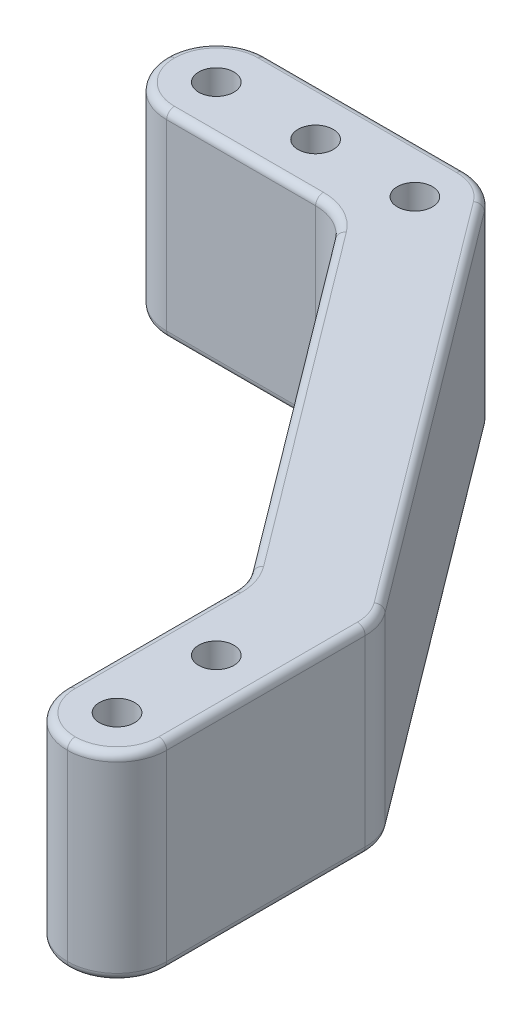
from build123d import *

# Parameters (mm, degrees)
SKETCH1_R           = 2.25
BOSS_EXTRUDE1_DEPTH = 25.4
FILLET1_R           = 6.35
FILLET2_R           = 1


with BuildPart() as part:
    # Sketch1 → Boss-Extrude1 (new body)
    with BuildSketch(Plane(origin=(0, 0, 0), x_dir=(1, 0, 0), z_dir=(0, 1, 0))):
        Polygon((-6.35, 6.35), (-6.35, -6.35), (22.225, -6.35), (57.15, -52.916666667), (57.15, -82.55), (69.85, -82.55), (69.85, -48.683333333), (28.575, 6.35), align=None)
        with Locations(Location((0, 0, 0), (0, 0, 270))):
            Circle(SKETCH1_R, mode=Mode.SUBTRACT)
        with Locations(Location((63.5, -76.2, 0), (0, 0, 270))):
            Circle(SKETCH1_R, mode=Mode.SUBTRACT)
        with Locations(Location((63.5, -63.5, 0), (0, 0, 270))):
            Circle(SKETCH1_R, mode=Mode.SUBTRACT)
        with Locations(Location((12.7, 0, 0), (0, 0, 270))):
            Circle(SKETCH1_R, mode=Mode.SUBTRACT)
        with Locations(Location((25.4, 0, 0), (0, 0, 270))):
            Circle(SKETCH1_R, mode=Mode.SUBTRACT)
    extrude(amount=BOSS_EXTRUDE1_DEPTH)

    # Fillet1
    fillet1_edges = [part.edges().sort_by_distance(p)[0] for p in [
        (28.575, 12.7, -6.35),
        (22.225, 12.7, 6.35),
        (69.85, 12.7, 48.683333333),
        (57.15, 12.7, 52.916666667),
        (69.85, 12.7, 82.55),
        (57.15, 12.7, 82.55),
        (-6.35, 12.7, -6.35),
        (-6.35, 12.7, 6.35),
    ]]
    fillet(fillet1_edges, radius=FILLET1_R - 0.0001)  # a hair under: the kernel refuses the full size

    # Fillet2
    fillet2_edges = [part.edges().sort_by_distance(p)[0] for p in [
        (12.699975, 0, -6.35),
        (12.699975, 25.4, -6.35),
        (49.529995, 0, 21.589993333),
        (69.85, 0, 63.500033333),
        (57.15, 0, 65.6167),
        (40.004995, 0, 30.05666),
        (9.524975, 0, 6.35),
        (-4.49015735, 0, 4.49015735),
        (-4.49015735, 0, -4.49015735),
        (59.00984265, 0, 80.69015735),
        (67.99015735, 0, 80.69015735),
        (69.524144074, 0, 48.791951975),
        (28.23981161, 0, -5.67962322),
        (49.529995, 25.4, 21.589993333),
        (9.524975, 25.4, 6.35),
        (40.004995, 25.4, 30.05666),
        (57.15, 25.4, 65.6167),
        (69.85, 25.4, 63.500033333),
        (-4.49015735, 25.4, 4.49015735),
        (-4.49015735, 25.4, -4.49015735),
        (59.00984265, 25.4, 80.69015735),
        (67.99015735, 25.4, 80.69015735),
        (69.524144074, 25.4, 48.791951975),
        (28.23981161, 25.4, -5.67962322),
        (21.88981161, 0, 7.02037678),
        (21.88981161, 25.4, 7.02037678),
        (56.824144074, 0, 53.025285309),
        (56.824144074, 25.4, 53.025285309),
    ]]
    fillet(fillet2_edges, radius=FILLET2_R)


solid = part.part
